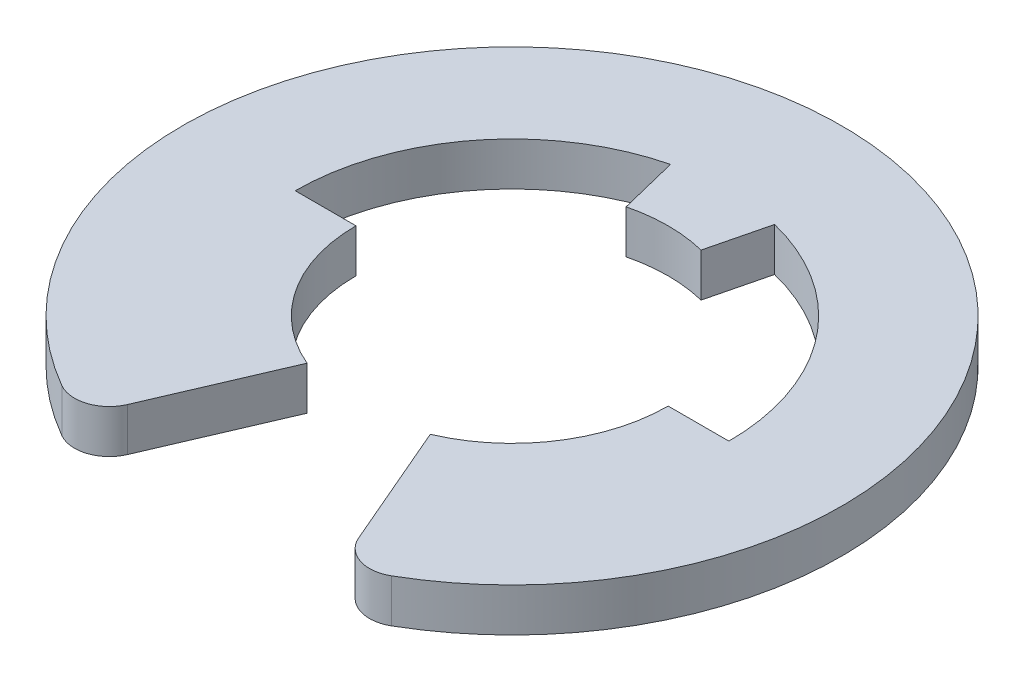
from build123d import *

# Parameters (mm, degrees)
BOSS_EXTRUDE1_DEPTH = 0.3175
FILLET1_R           = 0.508


with BuildPart() as part:
    # Sketch2 → Boss-Extrude1 (new, symmetric)
    with BuildSketch(Plane(origin=(0, 0, 0), x_dir=(1, 0, 0), z_dir=(0, 1, 0))):
        with BuildLine():
            Line((-3.175, 0), (-2.286, 0))
            ThreePointArc((-2.286, 0), (-1.909006314, -1.257573415), (-0.902368421, -2.100363595))
            Line((-0.902368421, -2.100363595), (-1.905, -4.434100924))
            ThreePointArc((-1.905, -4.434100924), (0, 4.826), (1.905, -4.434100924))
            Line((1.905, -4.434100924), (0.902368421, -2.100363595))
            ThreePointArc((0.902368421, -2.100363595), (1.909006314, -1.257573415), (2.286, 0))
            Line((2.286, 0), (3.175, 0))
            ThreePointArc((3.175, 0), (2.4999975, 1.957201446), (0.762, 3.082203919))
            Line((0.762, 3.082203919), (0.54864, 2.219186822))
            ThreePointArc((0.54864, 2.219186822), (0, 2.286), (-0.54864, 2.219186822))
            Line((-0.54864, 2.219186822), (-0.762, 3.082203919))
            ThreePointArc((-0.762, 3.082203919), (-2.4999975, 1.957201446), (-3.175, 0))
        make_face()
    extrude(amount=BOSS_EXTRUDE1_DEPTH, both=True)

    # Fillet1
    fillet1_edges = [part.edges().sort_by_distance(p)[0] for p in [
        (1.905, 0, 4.434100924),
        (-1.905, 0, 4.434100924),
    ]]
    fillet(fillet1_edges, radius=FILLET1_R)


solid = part.part
